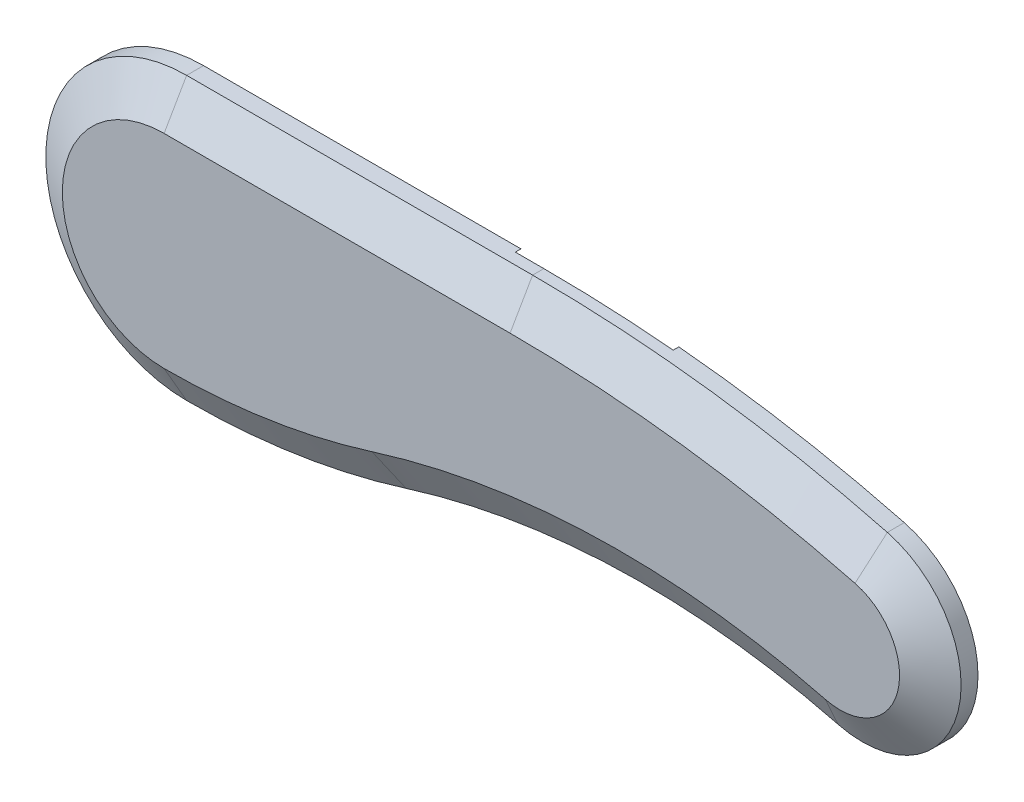
from build123d import *
from OCP.BRepFilletAPI import BRepFilletAPI_MakeChamfer

# Parameters (mm, degrees)
BOSS_EXTRUDE1_DEPTH = 7
CHAMFER1_SIZE       = 4
CHAMFER1_SIZE2      = 6.92820323
SKETCH3_R           = 8.5
CUT_EXTRUDE2_DEPTH  = 4
CUT_EXTRUDE3_DEPTH  = 3.5
SKETCH5_3_R         = 2.125
CUT_EXTRUDE4_DEPTH  = 140.843662709
CHAMFER2_SIZE       = 0.5
CHAMFER2_SIZE2      = 1.37373871
BOSS_EXTRUDE2_START = 0.5
SKETCH7_R           = 9.5
SKETCH7_R_2         = 8.5
BOSS_EXTRUDE2_DEPTH = 0.5
CUT_EXTRUDE5_DEPTH  = 1


with BuildPart() as part:
    # Sketch1 → Boss-Extrude1 (new body)
    with BuildSketch(Plane.XY):
        with BuildLine():
            Line((61.423127431, 25), (0, 25))
            ThreePointArc((0, 25), (-25, 0), (0, -25))
            ThreePointArc((0, -25), (19.714733683, -23.496417366), (38.973425347, -19.020450397))
            ThreePointArc((38.973425347, -19.020450397), (77.172636951, -12.631763464), (115.660534054, -16.953437271))
            ThreePointArc((115.660534054, -16.953437271), (136.944496251, -4.374248141), (124.409011914, 16.935483871))
            ThreePointArc((124.409011914, 16.935483871), (93.173159181, 22.975675186), (61.423127431, 25))
        make_face()
    extrude(amount=BOSS_EXTRUDE1_DEPTH)

    # Chamfer1: one chamfer whose edges measure the first distance from different faces: ONE call of the kernel's chamfer builder (chamfer() names one face for all edges)
    chamfer1_edges_1 = [part.edges().sort_by_distance(p)[0] for p in [
        (19.714733683, -23.496417366, 7),
    ]]
    chamfer1_side_1 = [part.faces().sort_by_distance(p)[0] for p in [
        (19.714733683, -23.496417366, 3.5),
    ]]
    chamfer1_edges_2 = [part.edges().sort_by_distance(p)[0] for p in [
        (-25, 0, 7),
    ]]
    chamfer1_side_2 = [part.faces().sort_by_distance(p)[0] for p in [
        (-25, 0, 3.5),
    ]]
    chamfer1_edges_3 = [part.edges().sort_by_distance(p)[0] for p in [
        (30.711563715, 25, 7),
    ]]
    chamfer1_side_3 = [part.faces().sort_by_distance(p)[0] for p in [
        (30.711563715, 25, 3.5),
    ]]
    chamfer1_edges_4 = [part.edges().sort_by_distance(p)[0] for p in [
        (93.173159181, 22.975675186, 7),
    ]]
    chamfer1_side_4 = [part.faces().sort_by_distance(p)[0] for p in [
        (93.173159181, 22.975675186, 3.5),
    ]]
    chamfer1_edges_5 = [part.edges().sort_by_distance(p)[0] for p in [
        (136.944496251, -4.374248141, 7),
    ]]
    chamfer1_side_5 = [part.faces().sort_by_distance(p)[0] for p in [
        (136.944496251, -4.374248141, 3.5),
    ]]
    chamfer1_edges_6 = [part.edges().sort_by_distance(p)[0] for p in [
        (77.172636951, -12.631763464, 7),
    ]]
    chamfer1_side_6 = [part.faces().sort_by_distance(p)[0] for p in [
        (77.172636951, -12.631763464, 3.5),
    ]]
    chamfer1 = BRepFilletAPI_MakeChamfer(part.part.solid().wrapped)
    for e in chamfer1_edges_1:
        chamfer1.Add(CHAMFER1_SIZE, CHAMFER1_SIZE2, e.wrapped, chamfer1_side_1[0].wrapped)  # the first distance lies on this face
    for e in chamfer1_edges_2:
        chamfer1.Add(CHAMFER1_SIZE, CHAMFER1_SIZE2, e.wrapped, chamfer1_side_2[0].wrapped)  # the first distance lies on this face
    for e in chamfer1_edges_3:
        chamfer1.Add(CHAMFER1_SIZE, CHAMFER1_SIZE2, e.wrapped, chamfer1_side_3[0].wrapped)  # the first distance lies on this face
    for e in chamfer1_edges_4:
        chamfer1.Add(CHAMFER1_SIZE, CHAMFER1_SIZE2, e.wrapped, chamfer1_side_4[0].wrapped)  # the first distance lies on this face
    for e in chamfer1_edges_5:
        chamfer1.Add(CHAMFER1_SIZE, CHAMFER1_SIZE2, e.wrapped, chamfer1_side_5[0].wrapped)  # the first distance lies on this face
    for e in chamfer1_edges_6:
        chamfer1.Add(CHAMFER1_SIZE, CHAMFER1_SIZE2, e.wrapped, chamfer1_side_6[0].wrapped)  # the first distance lies on this face
    add(Compound.cast(chamfer1.Shape()), mode=Mode.REPLACE)

    # Sketch3 → Cut-Extrude2 (cut)
    with BuildSketch(Plane(origin=(0, 0, 0), x_dir=(-1, 0, 0), z_dir=(0, 0, -1))):
        Circle(SKETCH3_R)
        with Locations((-120, 0)):
            Circle(SKETCH3_R)
    extrude(amount=-CUT_EXTRUDE2_DEPTH, mode=Mode.SUBTRACT)

    # Sketch5 → Cut-Extrude3 (cut)
    with BuildSketch(Plane(origin=(0, 0, 2), x_dir=(-1, 0, 0), z_dir=(0, 0, -1))):
        with BuildLine():
            Line((-86.046403676, 16.921929528), (-88.139298402, 13.296929528))
            Line((-88.139298402, 13.296929528), (-86.046403676, 9.671929528))
            Line((-86.046403676, 9.671929528), (-78.548867374, 9.671929528))
            ThreePointArc((-78.548867374, 9.671929528), (-67.767719499, 13.296929528), (-78.548867374, 16.921929528))
            Line((-78.548867374, 16.921929528), (-86.046403676, 16.921929528))
        make_face()
        with BuildLine():
            Line((-62.092894726, -3.625), (-54.595358423, -3.625))
            ThreePointArc((-54.595358423, -3.625), (-43.814210548, 0), (-54.595358423, 3.625))
            Line((-54.595358423, 3.625), (-62.092894726, 3.625))
            Line((-62.092894726, 3.625), (-64.185789452, 0))
            Line((-64.185789452, 0), (-62.092894726, -3.625))
        make_face()
        with BuildLine():
            Line((-32.163058591, -14.569644586), (-24.665522288, -14.569644586))
            ThreePointArc((-24.665522288, -14.569644586), (-13.884374414, -10.944644586), (-24.665522288, -7.319644586))
            Line((-24.665522288, -7.319644586), (-32.163058591, -7.319644586))
            Line((-32.163058591, -7.319644586), (-34.255953317, -10.944644586))
            Line((-34.255953317, -10.944644586), (-32.163058591, -14.569644586))
        make_face()
    extrude(amount=-CUT_EXTRUDE3_DEPTH, mode=Mode.SUBTRACT)

    # Sketch5<3> → Cut-Extrude4 (cut, through all)
    with BuildSketch(Plane(origin=(0, 0, 2), x_dir=(-1, 0, 0), z_dir=(0, 0, -1))):
        with BuildLine():
            ThreePointArc((-78.548867374, 9.671929528), (-67.767719499, 13.296929528), (-78.548867374, 16.921929528))
            ThreePointArc((-78.548867374, 16.921929528), (-79.767719499, 13.296929528), (-78.548867374, 9.671929528))
        make_face()
        with BuildLine():
            ThreePointArc((-54.595358423, 3.625), (-55.814210548, 0), (-54.595358423, -3.625))
            ThreePointArc((-54.595358423, -3.625), (-43.814210548, 0), (-54.595358423, 3.625))
        make_face()
        with BuildLine():
            ThreePointArc((-24.665522288, -7.319644586), (-25.884374414, -10.944644586), (-24.665522288, -14.569644586))
            ThreePointArc((-24.665522288, -14.569644586), (-13.884374414, -10.944644586), (-24.665522288, -7.319644586))
        make_face()
        with Locations((-83.953508951, 13.296929528)):
            Circle(SKETCH5_3_R)
        with Locations((-60, 0)):
            Circle(SKETCH5_3_R)
        with Locations((-30.070163865, -10.944644586)):
            Circle(SKETCH5_3_R)
    extrude(amount=CUT_EXTRUDE4_DEPTH, mode=Mode.SUBTRACT)

    # Chamfer2: one chamfer whose edges measure the first distance from different faces: ONE call of the kernel's chamfer builder (chamfer() names one face for all edges)
    chamfer2_edges_1 = [part.edges().sort_by_distance(p)[0] for p in [
        (67.767719499, 13.296929528, 5.5),
    ]]
    chamfer2_side_1 = [part.faces().sort_by_distance(p)[0] for p in [
        (68.986571624, 9.671929528, 2.75),
    ]]
    chamfer2_edges_2 = [part.edges().sort_by_distance(p)[0] for p in [
        (13.884374414, -10.944644586, 5.5),
    ]]
    chamfer2_side_2 = [part.faces().sort_by_distance(p)[0] for p in [
        (15.103226539, -14.569644586, 2.75),
    ]]
    chamfer2_edges_3 = [part.edges().sort_by_distance(p)[0] for p in [
        (43.814210548, 0, 5.5),
    ]]
    chamfer2_side_3 = [part.faces().sort_by_distance(p)[0] for p in [
        (45.033062674, -3.625, 2.75),
    ]]
    chamfer2 = BRepFilletAPI_MakeChamfer(part.part.solid().wrapped)
    for e in chamfer2_edges_1:
        chamfer2.Add(CHAMFER2_SIZE, CHAMFER2_SIZE2, e.wrapped, chamfer2_side_1[0].wrapped)  # the first distance lies on this face
    for e in chamfer2_edges_2:
        chamfer2.Add(CHAMFER2_SIZE, CHAMFER2_SIZE2, e.wrapped, chamfer2_side_2[0].wrapped)  # the first distance lies on this face
    for e in chamfer2_edges_3:
        chamfer2.Add(CHAMFER2_SIZE, CHAMFER2_SIZE2, e.wrapped, chamfer2_side_3[0].wrapped)  # the first distance lies on this face
    add(Compound.cast(chamfer2.Shape()), mode=Mode.REPLACE)

    # Sketch7 → Boss-Extrude2 (add)
    # profile 1 of 2: a face of its own
    with BuildSketch(Plane(origin=(0, 0, 0), x_dir=(-1, 0, 0), z_dir=(0, 0, -1)).offset(BOSS_EXTRUDE2_START)):
        Circle(SKETCH7_R)
        Circle(SKETCH7_R_2, mode=Mode.SUBTRACT)
    # profile 2 of 2: a face of its own
    with BuildSketch(Plane(origin=(0, 0, 0), x_dir=(-1, 0, 0), z_dir=(0, 0, -1)).offset(BOSS_EXTRUDE2_START)):
        with Locations((-120, 0)):
            Circle(SKETCH7_R)
        with Locations((-120, 0)):
            Circle(SKETCH7_R_2, mode=Mode.SUBTRACT)
    extrude(amount=-BOSS_EXTRUDE2_DEPTH)

    # Sketch8 → Cut-Extrude5 (cut)
    with BuildSketch(Plane(origin=(0, 0, 0), x_dir=(-1, 0, 0), z_dir=(0, 0, -1))):
        with BuildLine():
            Line((-89.428119539, 18.972729025), (-93.616268896, 7.465883237))
            ThreePointArc((-93.616268896, 7.465883237), (-93.832692842, 2.508959933), (-91.166802555, -1.675649601))
            Line((-91.166802555, -1.675649601), (-80.016279798, -11.032049133))
            ThreePointArc((-80.016279798, -11.032049133), (-77.697567105, -12.403511526), (-75.060647403, -12.954866342))
            ThreePointArc((-75.060647403, -12.954866342), (-56.847470563, -14.924185147), (-39.048374242, -19.258951263))
            ThreePointArc((-39.048374242, -19.258951263), (-29.540851985, -21.855825897), (-19.864187883, -23.726363033))
            ThreePointArc((-19.864187883, -23.726363033), (-13.388522585, -21.963525136), (-10.365633414, -15.971532183))
            ThreePointArc((-10.365633414, -15.971532183), (-11.215405969, -12.703904149), (-13.30299778, -10.050327921))
            Line((-13.30299778, -10.050327921), (-53.072047052, 23.319866656))
            ThreePointArc((-53.072047052, 23.319866656), (-55.55337865, 24.752464121), (-58.375044832, 25.25))
            Line((-58.375044832, 25.25), (-61.423127431, 25.25))
            ThreePointArc((-61.423127431, 25.25), (-71.903800566, 25.030434129), (-82.366082508, 24.372121803))
            ThreePointArc((-82.366082508, 24.372121803), (-86.68653993, 22.704957593), (-89.428119539, 18.972729025))
        make_face()
    extrude(amount=-CUT_EXTRUDE5_DEPTH, mode=Mode.SUBTRACT)


solid = part.part
